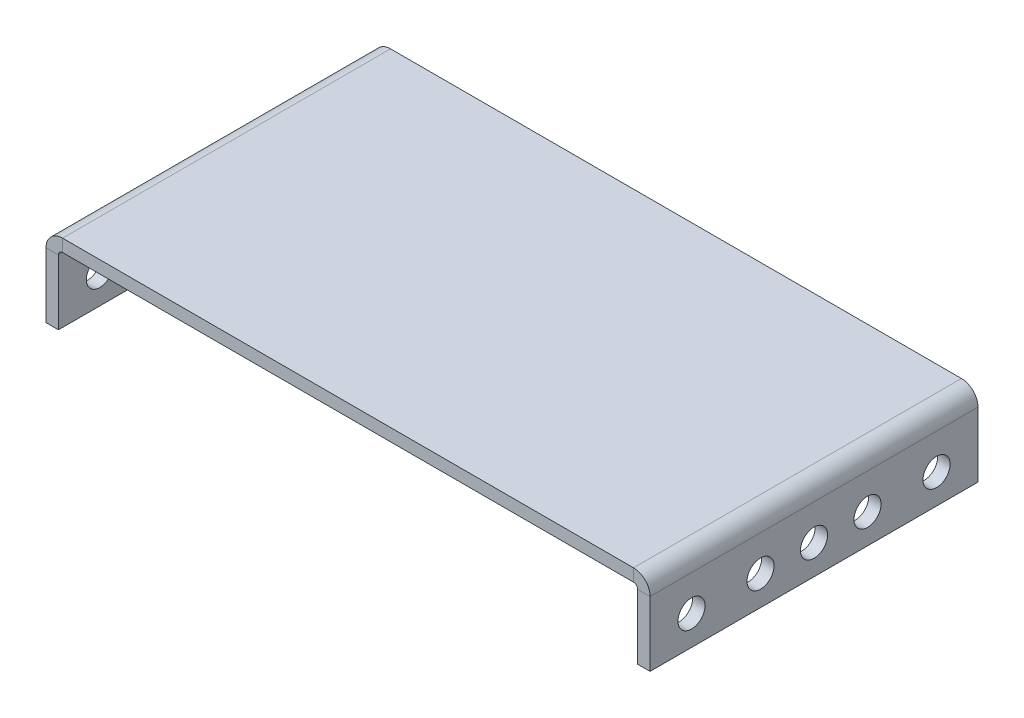
from build123d import *

# Parameters (mm, degrees)
BASE_FLANGE1_DEPTH      = 60.325
CUT_EXTRUDE1_DEPTH      = 83.467433131
CUT_EXTRUDE1_DEPTH_BACK = 83.467433131
SKETCH6_R               = 2.4892


# Sheet-metal steps are written as plain solids
with BuildPart() as part:
    # Sketch1 → Base-Flange1 (new body)
    with BuildSketch(Plane.XY):
        with BuildLine():
            Line((-53.2765, -6.35), (-53.2765, 5.588))
            ThreePointArc((-53.2765, 5.588), (-53.053315367, 6.126815367), (-52.5145, 6.35))
            Line((-52.5145, 6.35), (52.5145, 6.35))
            ThreePointArc((52.5145, 6.35), (53.053315367, 6.126815367), (53.2765, 5.588))
            Line((53.2765, 5.588), (53.2765, -6.35))
            Line((53.2765, -6.35), (55.5625, -6.35))
            Line((55.5625, -6.35), (55.5625, 5.588))
            ThreePointArc((55.5625, 5.588), (54.669761469, 7.743261469), (52.5145, 8.636))
            Line((52.5145, 8.636), (-52.5145, 8.636))
            ThreePointArc((-52.5145, 8.636), (-54.669761469, 7.743261469), (-55.5625, 5.588))
            Line((-55.5625, 5.588), (-55.5625, -6.35))
            Line((-55.5625, -6.35), (-53.2765, -6.35))
        make_face()
    extrude(amount=BASE_FLANGE1_DEPTH)

    # Sketch6 → Cut-Extrude1 (cut, two sides: drawn at the far end of the back side and taken through both)
    with BuildSketch(Plane(origin=(0, 0, 0), x_dir=(0, 0, -1), z_dir=(1, 0, 0)).offset(-CUT_EXTRUDE1_DEPTH_BACK)):
        with Locations((-30.1625, -0.92202)):
            Circle(SKETCH6_R)
        with Locations((-20.32, -0.92202)):
            Circle(SKETCH6_R)
        with Locations((-7.62, -0.92202)):
            Circle(SKETCH6_R)
        with Locations(Location((-52.705, -0.92202, 0), (0, 0, 180))):
            Circle(SKETCH6_R)
        with Locations(Location((-40.005, -0.92202, 0), (0, 0, 180))):
            Circle(SKETCH6_R)
    extrude(amount=CUT_EXTRUDE1_DEPTH + CUT_EXTRUDE1_DEPTH_BACK, mode=Mode.SUBTRACT)


solid = part.part
